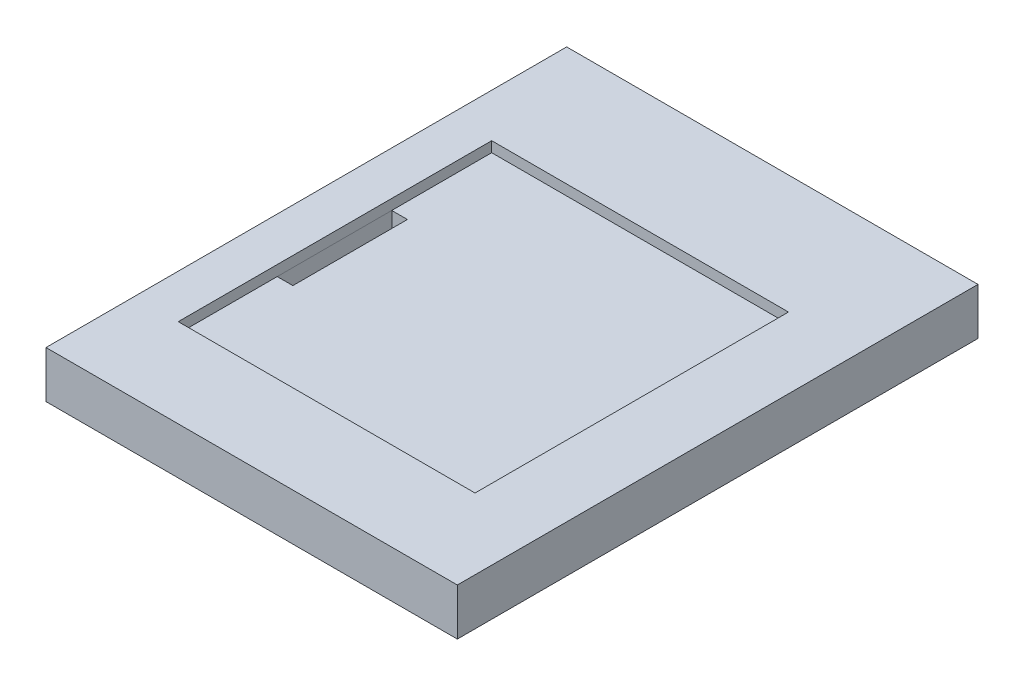
from build123d import *

# Parameters (mm, degrees)
SKETCH3_W           = 39.5
SKETCH3_H           = 50
SKETCH3_W_2         = 33.5
SKETCH3_H_2         = 44
BOSS_EXTRUDE1_DEPTH = 2
SKETCH4_W           = 39.5
SKETCH4_H           = 50
BOSS_EXTRUDE2_DEPTH = 1.5
SKETCH5_W           = 1.5
SKETCH5_H           = 11
CUT_EXTRUDE1_DEPTH  = 3
SKETCH6_R           = 0.75
CUT_EXTRUDE2_DEPTH  = 2.5
LPATTERN1_COUNT     = 4
LPATTERN1_PITCH     = 15
SKETCH7_W           = 39.5
SKETCH7_H           = 50
SKETCH7_W_2         = 28.5
SKETCH7_H_2         = 30.1
BOSS_EXTRUDE3_DEPTH = 1


with BuildPart() as part:
    # Sketch3 → Boss-Extrude1 (new body)
    with BuildSketch(Plane(origin=(0, 0, 0), x_dir=(1, 0, 0), z_dir=(0, 1, 0))):
        with Locations((19.75, 25)):
            Rectangle(SKETCH3_W, SKETCH3_H)
        with Locations((19.75, 25)):
            Rectangle(SKETCH3_W_2, SKETCH3_H_2, mode=Mode.SUBTRACT)
    extrude(amount=BOSS_EXTRUDE1_DEPTH)

    # Sketch4 → Boss-Extrude2 (add)
    with BuildSketch(Plane(origin=(0, 2, 0), x_dir=(1, 0, 0), z_dir=(0, 1, 0))):
        with Locations((19.75, 25)):
            Rectangle(SKETCH4_W, SKETCH4_H)
    extrude(amount=BOSS_EXTRUDE2_DEPTH)

    # Sketch5 → Cut-Extrude1 (cut)
    with BuildSketch(Plane(origin=(0, 3.5, 0), x_dir=(1, 0, 0), z_dir=(0, 1, 0))):
        with Locations((4.956023136, 23.5)):
            Rectangle(SKETCH5_W, SKETCH5_H)
    extrude(amount=-CUT_EXTRUDE1_DEPTH, mode=Mode.SUBTRACT)

    # Sketch6 → Cut-Extrude2 (cut)
    with BuildSketch(Plane.XZ):
        with Locations((1.5, -47.5)):
            Circle(SKETCH6_R)
        with Locations((38, -47.5)):
            Circle(SKETCH6_R)
    cut_extrude2 = extrude(amount=-CUT_EXTRUDE2_DEPTH, mode=Mode.SUBTRACT)

    # LPattern1: Cut-Extrude2 ×4
    with Locations(*[(0, 0, i * LPATTERN1_PITCH) for i in range(1, LPATTERN1_COUNT)]):
        add(cut_extrude2, mode=Mode.SUBTRACT)

    # Sketch7 → Boss-Extrude3 (add)
    with BuildSketch(Plane(origin=(0, 3.5, 0), x_dir=(1, 0, 0), z_dir=(0, 1, 0))):
        with Locations((19.75, 25)):
            Rectangle(SKETCH7_W, SKETCH7_H)
        with Locations((18.45, 23.55)):
            Rectangle(SKETCH7_W_2, SKETCH7_H_2, mode=Mode.SUBTRACT)
    extrude(amount=BOSS_EXTRUDE3_DEPTH)


solid = part.part
